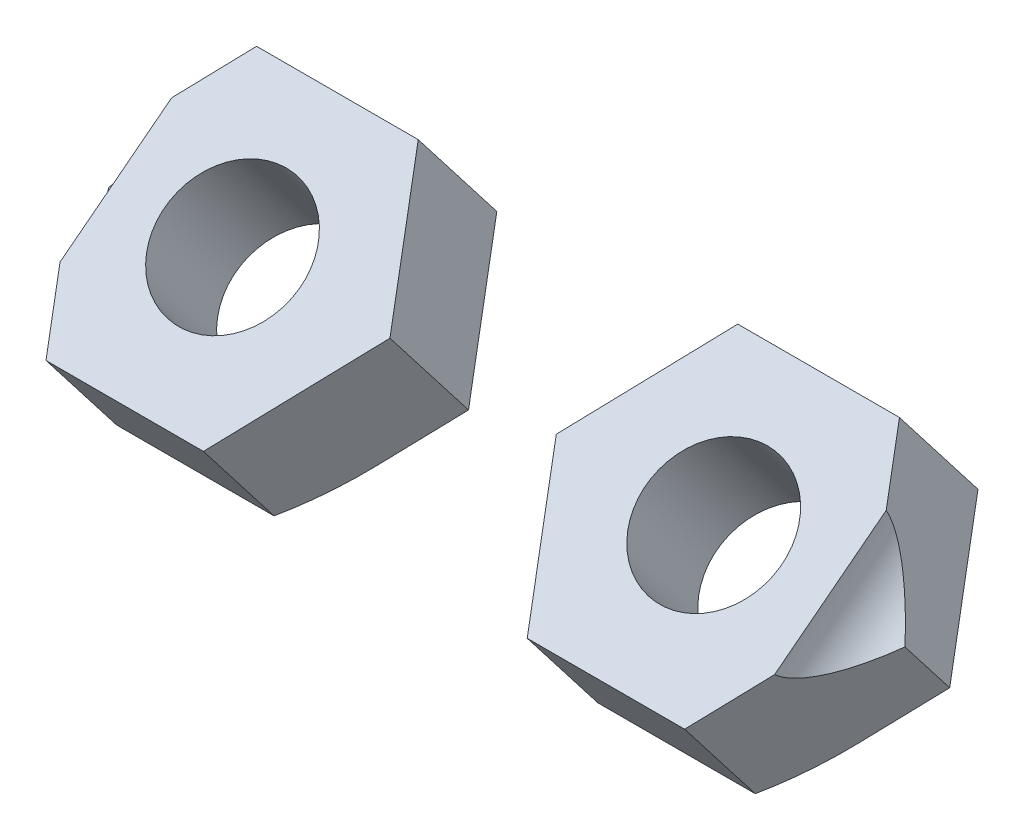
from build123d import *

# Parameters (mm, degrees)
SKETCH1_W                    = 70
SKETCH1_H                    = 60
BOSS_EXTRUDE1_DEPTH          = 23.5
SKETCH2_R                    = 4.5
CUT_EXTRUDE1_DEPTH           = 80.701003758
CUT_EXTRUDE4_DEPTH           = 80.701003758
M10_TAPPED_HOLE1_D           = 8.5
M10_TAPPED_HOLE1_DEPTH       = 27.5
M10_TAPPED_HOLE1_CSINK_D     = 10.05
M10_TAPPED_HOLE1_CSINK_ANGLE = 90
M10_TAPPED_HOLE1_TIP         = 2.553657631
M10_TAPPED_HOLE2_D           = 8.5
M10_TAPPED_HOLE2_CSINK_D     = 10.05
M10_TAPPED_HOLE2_CSINK_ANGLE = 90
SKETCH5_W                    = 3
SKETCH5_H                    = 31.956569969
SKETCH5_W_2                  = 11.5
SKETCH5_H_2                  = 27.892636229
CUT_EXTRUDE2_DEPTH           = 52.742149163
CHAMFER1_SIZE                = 3
FILLET1_R                    = 12
SKETCH9_OUTSIDE_W            = 88.936
SKETCH9_OUTSIDE_H            = 66.094
CUT_EXTRUDE5_DEPTH           = 10
CUT_EXTRUDE6_DEPTH           = 80.701003758


with BuildPart() as part:
    # Sketch1 → Boss-Extrude1 (new body)
    with BuildSketch(Plane(origin=(0, 0, 0), x_dir=(1, 0, 0), z_dir=(0, 1, 0))):
        Rectangle(SKETCH1_W, SKETCH1_H)
    extrude(amount=BOSS_EXTRUDE1_DEPTH)

    # Sketch2 → Cut-Extrude1 (cut, through all)
    with BuildSketch(Plane(origin=(35, 0, 0), x_dir=(0, 0, -1), z_dir=(1, 0, 0))):
        with Locations((-18.25, 11.75)):
            Circle(SKETCH2_R)
    extrude(amount=-CUT_EXTRUDE1_DEPTH, mode=Mode.SUBTRACT)

    # Sketch6 → Cut-Extrude4 (cut, through all)
    with BuildSketch(Plane.ZY.offset(35)):
        Polygon((1.633407015, 0), (-11.44579872, 10.127003094), (5.022332022, 31.39588867), (-21.600150891, 35.884663023), (-49.264135094, 11.821162325), (1.633407015, -46.691886902), align=None)
    extrude(amount=-CUT_EXTRUDE4_DEPTH, mode=Mode.SUBTRACT)

    # M10 Tapped Hole1
    with Locations(Plane(origin=(0, 11.814481877, -13.625207767), x_dir=(-1, 0, 0), z_dir=(0, -0.7906895737438469, -0.612217280034445))):
        with Locations((-15, -11.027098629), (15, -11.027098629)):
            CounterSinkHole(M10_TAPPED_HOLE1_D / 2, M10_TAPPED_HOLE1_CSINK_D / 2, depth=M10_TAPPED_HOLE1_DEPTH, counter_sink_angle=M10_TAPPED_HOLE1_CSINK_ANGLE)
            with Locations((0, 0, -(M10_TAPPED_HOLE1_DEPTH + M10_TAPPED_HOLE1_TIP / 2))):  # 118° drill point
                Cone(0, M10_TAPPED_HOLE1_D / 2, M10_TAPPED_HOLE1_TIP, mode=Mode.SUBTRACT)

    # M10 Tapped Hole2 (through all)
    with Locations(Plane(origin=(0, 9.336313521, -12.058016), x_dir=(-1, 0, 0), z_dir=(0, 0.6122172800344449, -0.790689573743847))):
        with Locations((-26.5, 9.456540563), (0, 9.456540563), (26.5, 9.456540563)):
            CounterSinkHole(M10_TAPPED_HOLE2_D / 2, M10_TAPPED_HOLE2_CSINK_D / 2, counter_sink_angle=M10_TAPPED_HOLE2_CSINK_ANGLE)

    # Sketch5 → Cut-Extrude2 (cut, through all)
    with BuildSketch(Plane(origin=(0, 23.5, 0), x_dir=(1, 0, 0), z_dir=(0, 1, 0))):
        with Locations((-25.25926979, -22.978284985)):
            Rectangle(SKETCH5_W, SKETCH5_H)
        with Locations((0, -20.946318115)):
            Rectangle(SKETCH5_W_2, SKETCH5_H_2)
        with Locations((25.25926979, -22.978284985)):
            Rectangle(SKETCH5_W, SKETCH5_H)
    extrude(amount=-CUT_EXTRUDE2_DEPTH, mode=Mode.SUBTRACT)

    # Chamfer1
    chamfer1_edges = [part.edges().sort_by_distance(p)[0] for p in [
        (30.879634895, 0, 30),
        (30.879634895, 23.5, 30),
        (14.754634895, 0, 30),
        (14.754634895, 23.5, 30),
        (-30.879634895, 0, 30),
        (-30.879634895, 23.5, 30),
        (-14.754634895, 0, 30),
        (-14.754634895, 23.5, 30),
    ]]
    chamfer(chamfer1_edges, length=CHAMFER1_SIZE)

    # Fillet1
    # the kernel refuses this fillet: 12 mm, written as the material it takes off along each edge
    with BuildSketch(Plane(origin=(-45.256673558, 0, 1.633407015), x_dir=(0, 0, 1), z_dir=(1, 0, 0))) as fillet1_piece_1:
        with BuildLine():
            CenterArc((FILLET1_R * 0.341889118589, -FILLET1_R), FILLET1_R, 90, 37.75)
            Line((-FILLET1_R * 0.270328161445, -FILLET1_R * 0.209310426256), (0, 0))
            Line((0, 0), (FILLET1_R * 0.341889118589, 0))
        make_face()
    extrude(amount=90.513347115, mode=Mode.SUBTRACT)

    # Sketch9 outside → Cut-Extrude5 (cut)
    with BuildSketch(Plane(origin=(0, 10.739220374, -12.236488293), x_dir=(-1, 0, 0), z_dir=(0, 0.7906895737438466, 0.612217280034445))):
        with Locations((0, 16.392)):
            Rectangle(SKETCH9_OUTSIDE_W, SKETCH9_OUTSIDE_H)
        Polygon((19.907477288, 0.770758948), (24.814954576, 9.270758948), (19.907477288, 17.770758948), (10.092522712, 17.770758948), (5.185045424, 9.270758948), (10.092522712, 0.770758948), align=None, mode=Mode.SUBTRACT)
        Polygon((-10.092522712, 0.770758948), (-5.185045424, 9.270758948), (-10.092522712, 17.770758948), (-19.907477288, 17.770758948), (-24.814954576, 9.270758948), (-19.907477288, 0.770758948), align=None, mode=Mode.SUBTRACT)
    extrude(amount=CUT_EXTRUDE5_DEPTH, mode=Mode.SUBTRACT)

    # Sketch10 → Cut-Extrude6 (cut, through all)
    with BuildSketch(Plane(origin=(35, 0, 0), x_dir=(0, 0, -1), z_dir=(1, 0, 0))):
        Polygon((-12.900576366, 61.118553113), (16.010624605, 23.779219648), (-27.760891181, -10.112308997), (-56.672092153, 27.227024468), align=None)
    extrude(amount=-CUT_EXTRUDE6_DEPTH, mode=Mode.SUBTRACT)


with BuildPart() as cut_extrude6_piece_1:
    # of the separate pieces the step leaves, piece 1, a body of its own (cut_extrude6_pieces)
    add(part.part.solids().sort_by_distance((-9.960170329, 16.452519684, -6.548060479))[0])


with BuildPart() as cut_extrude6_piece_2:
    # of the separate pieces the step leaves, piece 2, a body of its own (cut_extrude6_pieces)
    add(part.part.solids().sort_by_distance((20.039829671, 16.452519684, -6.548060479))[0])


solid = Compound([cut_extrude6_piece_1.part, cut_extrude6_piece_2.part])
